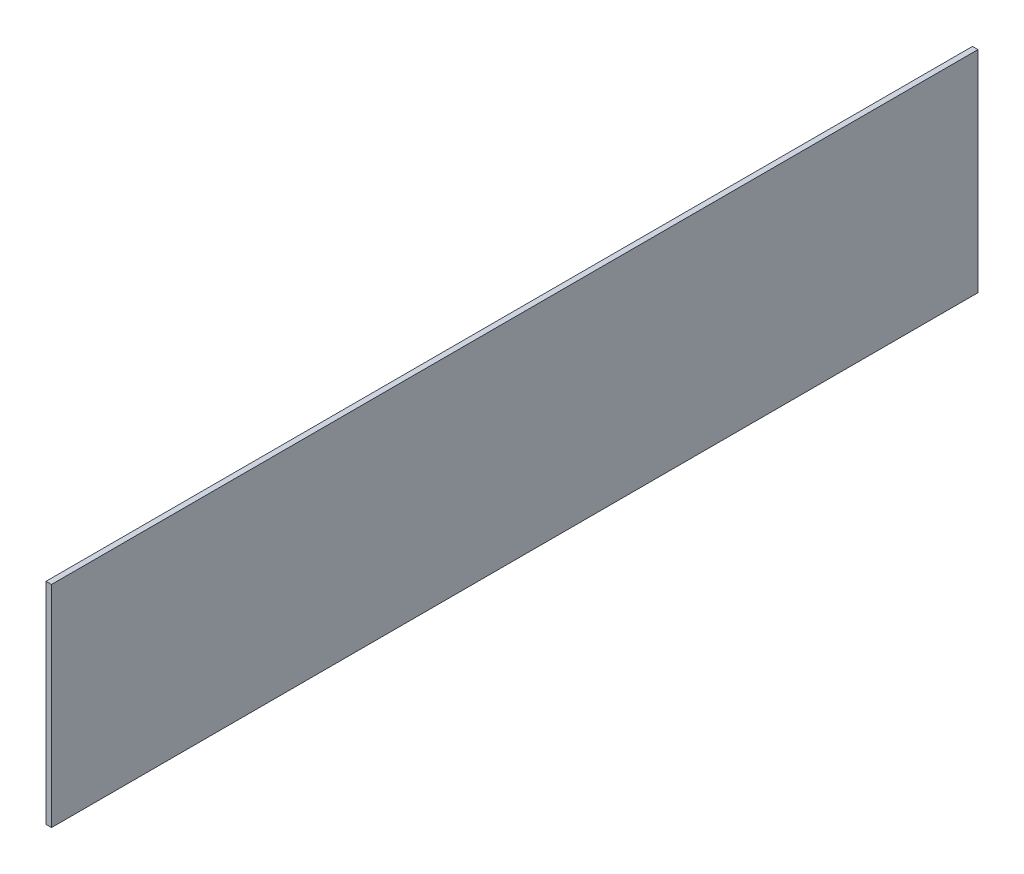
from build123d import *

# Parameters (mm, degrees)
SKETCH_1_W             = 506
SKETCH_1_H             = 115
SM_BASE_FLANGE_1_DEPTH = 3


# Sheet-metal steps are written as plain solids
with BuildPart() as part:
    # Sketch 1 → Базовая кромка1 (new body)
    with BuildSketch(Plane(origin=(0, 0, 0), x_dir=(0, 0, -1), z_dir=(1, 0, 0))):
        Rectangle(SKETCH_1_W, SKETCH_1_H)
    extrude(amount=-SM_BASE_FLANGE_1_DEPTH)


solid = part.part
